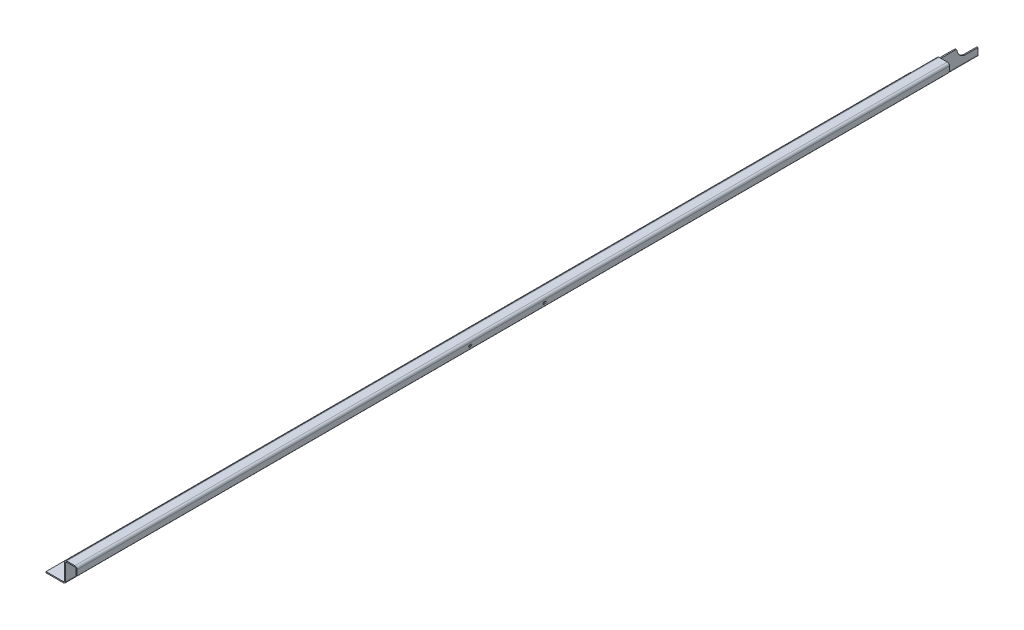
from build123d import *

# Parameters (mm, degrees)
SM_BASE_FLANGE_1_DEPTH           = 8
SM_EDGE_FLANGE_1_STRIP_W         = 48
SM_EDGE_FLANGE_1_STRIP_H         = 8
SM_EDGE_FLANGE_1_STRIP_CUT_DEPTH = 6215
SM_EDGE_FLANGE_1_DEPTH           = 6215
SM_EDGE_FLANGE_2_STRIP_W         = 48
SM_EDGE_FLANGE_2_STRIP_H         = 8
SM_EDGE_FLANGE_2_STRIP_CUT_DEPTH = 6215
SM_EDGE_FLANGE_2_DEPTH           = 6215
SM_EDGE_FLANGE_3_STRIP_W         = 48
SM_EDGE_FLANGE_3_STRIP_H         = 8
SM_EDGE_FLANGE_3_STRIP_CUT_DEPTH = 6500
SM_EDGE_FLANGE_3_DEPTH           = 6500
FILLET_1_R                       = 10
SKETCH_15_R                      = 9.5
CUT_EXTRUDE_1_DEPTH              = 6504.169150499
CUT_EXTRUDE_2_DEPTH              = 10
SKETCH_17_R                      = 9.5
CUT_EXTRUDE_3_DEPTH              = 10
CUT_EXTRUDE_START                = -6500
CUT_EXTRUDE_4_DEPTH              = 238
CUT_EXTRUDE_START_2              = -6262
CUT_EXTRUDE_4_2_OUTLINE_W        = 55
CUT_EXTRUDE_4_2_OUTLINE_H        = 8
CUT_EXTRUDE_4_2_DEPTH            = 102


# Read off the part's stored shape, not the designer's step: 切除-拉伸4
# Sheet-metal steps are written as plain solids
with BuildPart() as part:
    # Sketch 1 → 基体-法兰1 (new body)
    with BuildSketch(Plane(origin=(0, 0, 0), x_dir=(0, 0, -1), z_dir=(1, 0, 0))):
        with BuildLine():
            Line((0, 0), (6215, 0))
            Line((6215, 0), (6215, -20))
            Line((6215, -20), (6350.001923105, -20))
            ThreePointArc((6350.001923105, -20), (6368.861621181, -66.284822813), (6415, -85.5))
            Line((6415, -85.5), (6500, -85.5))
            Line((6500, -85.5), (6500, -147))
            Line((6500, -147), (0, -147))
            Line((0, -147), (0, 0))
        make_face()
        with BuildLine():
            Line((6120, -82.5), (6220, -82.5))
            ThreePointArc((6220, -82.5), (6227.5, -90), (6220, -97.5))
            Line((6220, -97.5), (6120, -97.5))
            ThreePointArc((6120, -97.5), (6112.5, -90), (6120, -82.5))
        make_face(mode=Mode.SUBTRACT)
    extrude(amount=-SM_BASE_FLANGE_1_DEPTH)

    # 边线-法兰1 strip (across the edge) → 边线-法兰1 strip cut (cut)
    with BuildSketch(Plane(origin=(0, 0, -6215), x_dir=(0, -1, 0), z_dir=(0, 0, 1))):
        with Locations((-8, -4)):
            Rectangle(SM_EDGE_FLANGE_1_STRIP_W, SM_EDGE_FLANGE_1_STRIP_H)
    extrude(amount=SM_EDGE_FLANGE_1_STRIP_CUT_DEPTH, mode=Mode.SUBTRACT)

    # 边线-法兰1 section (across the edge) → 边线-法兰1 (add)
    with BuildSketch(Plane(origin=(0, 0, -6215), x_dir=(0, -1, 0), z_dir=(0, 0, 1))):
        with BuildLine():
            Line((0, 8), (0, 74))
            Line((0, 74), (8, 74))
            Line((8, 74), (8, 8))
            ThreePointArc((8, 8), (10.343145751, 2.343145751), (16, 0))
            Line((16, 0), (16, -8))
            ThreePointArc((16, -8), (4.686291501, -3.313708499), (0, 8))
        make_face()
    extrude(amount=SM_EDGE_FLANGE_1_DEPTH)

    # 边线-法兰2 strip (across the edge) → 边线-法兰2 strip cut (cut)
    with BuildSketch(Plane(origin=(74, -8, -6215), x_dir=(-1, 0, 0), z_dir=(0, 0, 1))):
        with Locations((-16, -4)):
            Rectangle(SM_EDGE_FLANGE_2_STRIP_W, SM_EDGE_FLANGE_2_STRIP_H)
    extrude(amount=SM_EDGE_FLANGE_2_STRIP_CUT_DEPTH, mode=Mode.SUBTRACT)

    # 边线-法兰2 section (across the edge) → 边线-法兰2 (add)
    with BuildSketch(Plane(origin=(74, -8, -6215), x_dir=(-1, 0, 0), z_dir=(0, 0, 1))):
        with BuildLine():
            Line((-8, 8), (-8, 47))
            Line((-8, 47), (0, 47))
            Line((0, 47), (0, 8))
            ThreePointArc((0, 8), (2.343145751, 2.343145751), (8, 0))
            Line((8, 0), (8, -8))
            ThreePointArc((8, -8), (-3.313708499, -3.313708499), (-8, 8))
        make_face()
    extrude(amount=SM_EDGE_FLANGE_2_DEPTH)

    # 边线-法兰3 strip (across the edge) → 边线-法兰3 strip cut (cut)
    with BuildSketch(Plane(origin=(-8, -147, -6500), x_dir=(0, 1, 0), z_dir=(0, 0, 1))):
        with Locations((-8, -4)):
            Rectangle(SM_EDGE_FLANGE_3_STRIP_W, SM_EDGE_FLANGE_3_STRIP_H)
    extrude(amount=SM_EDGE_FLANGE_3_STRIP_CUT_DEPTH, mode=Mode.SUBTRACT)

    # 边线-法兰3 section (across the edge) → 边线-法兰3 (add)
    with BuildSketch(Plane(origin=(-8, -147, -6500), x_dir=(0, 1, 0), z_dir=(0, 0, 1))):
        with BuildLine():
            Line((0, 8), (0, 132))
            Line((0, 132), (8, 132))
            Line((8, 132), (8, 8))
            ThreePointArc((8, 8), (10.343145751, 2.343145751), (16, 0))
            Line((16, 0), (16, -8))
            ThreePointArc((16, -8), (4.686291501, -3.313708499), (0, 8))
        make_face()
    extrude(amount=SM_EDGE_FLANGE_3_DEPTH)

    # 圆角1
    fillet_1_edges = [part.edges().sort_by_distance(p)[0] for p in [
        (78, -55, -6215),
        (-4, -20, -6350.001923105),
    ]]
    fillet(fillet_1_edges, radius=FILLET_1_R)

    # 草图15 → 切除-拉伸1 (cut, through all)
    with BuildSketch(Plane(origin=(0, 0, 0), x_dir=(0, 0, -1), z_dir=(1, 0, 0))):
        with Locations((3040, -117)):
            Circle(SKETCH_15_R)
        with Locations((3090, -117)):
            Circle(SKETCH_15_R)
        with Locations((3140, -117)):
            Circle(SKETCH_15_R)
        with Locations((3190, -117)):
            Circle(SKETCH_15_R)
        with Locations((2990, -117)):
            Circle(SKETCH_15_R)
        with Locations((2940, -117)):
            Circle(SKETCH_15_R)
        with BuildLine():
            Line((2806.5, -112), (2806.5, -122))
            ThreePointArc((2806.5, -122), (2800, -128.5), (2793.5, -122))
            Line((2793.5, -122), (2793.5, -112))
            ThreePointArc((2793.5, -112), (2800, -105.5), (2806.5, -112))
        make_face()
        with BuildLine():
            Line((3336.5, -112), (3336.5, -122))
            ThreePointArc((3336.5, -122), (3330, -128.5), (3323.5, -122))
            Line((3323.5, -122), (3323.5, -112))
            ThreePointArc((3323.5, -112), (3330, -105.5), (3336.5, -112))
        make_face()
    extrude(amount=-CUT_EXTRUDE_1_DEPTH, mode=Mode.SUBTRACT)

    # 草图16 → 切除-拉伸2 (cut)
    with BuildSketch(Plane(origin=(82, 0, 0), x_dir=(0, 0, -1), z_dir=(1, 0, 0))):
        with BuildLine():
            Line((2795, -28.5), (2805, -28.5))
            ThreePointArc((2805, -28.5), (2811.5, -35), (2805, -41.5))
            Line((2805, -41.5), (2795, -41.5))
            ThreePointArc((2795, -41.5), (2788.5, -35), (2795, -28.5))
        make_face()
        with BuildLine():
            Line((3325, -28.5), (3335, -28.5))
            ThreePointArc((3335, -28.5), (3341.5, -35), (3335, -41.5))
            Line((3335, -41.5), (3325, -41.5))
            ThreePointArc((3325, -41.5), (3318.5, -35), (3325, -28.5))
        make_face()
    extrude(amount=-CUT_EXTRUDE_2_DEPTH, mode=Mode.SUBTRACT)

    # 草图17 → 切除-拉伸3 (cut)
    with BuildSketch(Plane(origin=(0, 0, 0), x_dir=(0, 0, -1), z_dir=(1, 0, 0))):
        with Locations((5900, -117)):
            Circle(SKETCH_17_R)
        with Locations((5850, -117)):
            Circle(SKETCH_17_R)
    extrude(amount=-CUT_EXTRUDE_3_DEPTH, mode=Mode.SUBTRACT)

    # 切除-拉伸4 outline → 切除-拉伸4 (cut)
    with BuildSketch(Plane.XY.offset(CUT_EXTRUDE_START)):
        with BuildLine():
            Line((-140, -147), (-16, -147))
            ThreePointArc((-16, -147), (-7.05572809, -144.266499161), (-1.167603026, -137))
            Line((-1.167603026, -137), (-8.583801513, -134))
            ThreePointArc((-8.583801513, -134), (-11.527864045, -137.63324958), (-16, -139))
            Line((-16, -139), (-140, -139))
            Line((-140, -139), (-140, -147))
        make_face()
    extrude(amount=CUT_EXTRUDE_4_DEPTH, mode=Mode.SUBTRACT)

    # Cut-Extrude 4 2 outline → Cut-Extrude 4 2 (cut)
    with BuildSketch(Plane.XY.offset(CUT_EXTRUDE_START_2)):
        with Locations((-112.5, -143)):
            Rectangle(CUT_EXTRUDE_4_2_OUTLINE_W, CUT_EXTRUDE_4_2_OUTLINE_H)
    extrude(amount=CUT_EXTRUDE_4_2_DEPTH, mode=Mode.SUBTRACT)


solid = part.part
